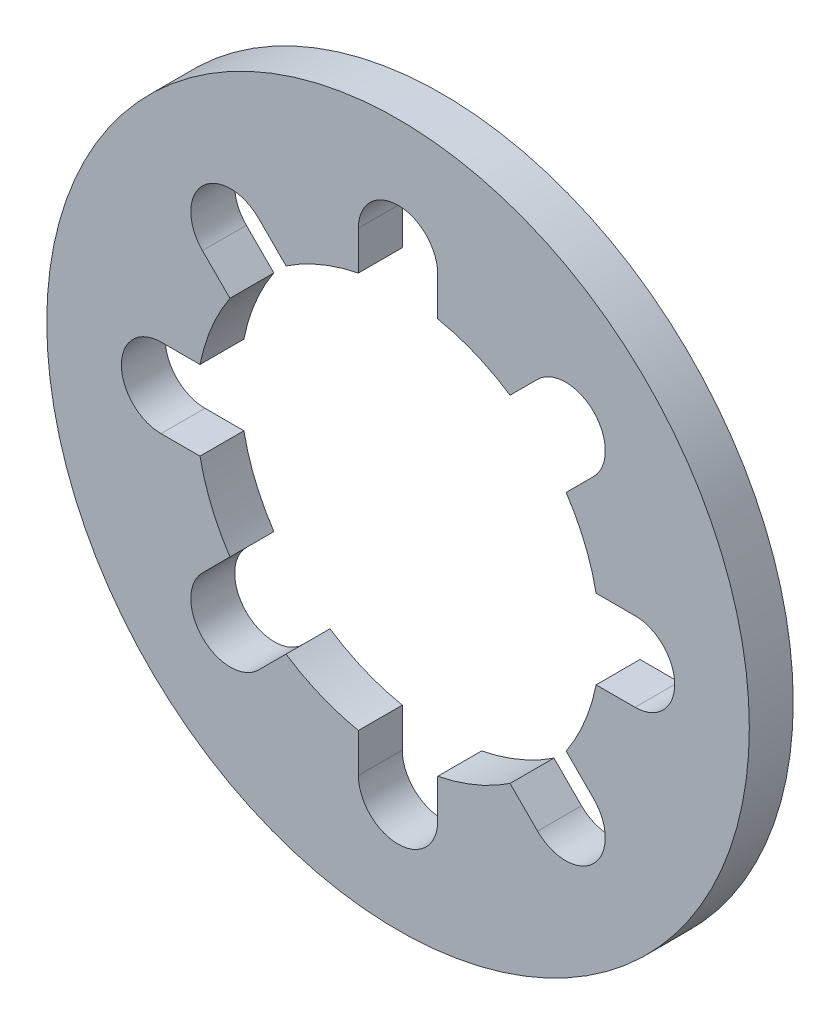
from build123d import *

# Parameters (mm, degrees)
SKETCH1_R          = 4
SKETCH1_R_2        = 2.3
BASE_EXTRUDE_DEPTH = 0.5
TYPEBSLOT_DEPTH    = 10.430473108
TYPEBPATTERN_COUNT = 8


with BuildPart() as part:
    # Sketch1 → Base-Extrude (new body)
    with BuildSketch(Plane.XY):
        Circle(SKETCH1_R)
        Circle(SKETCH1_R_2, mode=Mode.SUBTRACT)
    extrude(amount=-BASE_EXTRUDE_DEPTH)

    # Sketch2 → TypeBSlot (cut, through all)
    with BuildSketch(Plane(origin=(-2.555442923, 2.760916441, 0), x_dir=(1, 0, 0), z_dir=(0, 0, 1))):
        with BuildLine():
            Line((2.10383936, -0.505688244), (2.10383936, -0.062520004))
            ThreePointArc((2.10383936, -0.062520004), (2.555442923, 0.389083559), (3.007046485, -0.062520004))
            Line((3.007046485, -0.062520004), (3.007046485, -0.505688244))
            Line((3.007046485, -0.505688244), (2.10383936, -0.505688244))
        make_face()
    typebslot = extrude(amount=-TYPEBSLOT_DEPTH, mode=Mode.SUBTRACT)

    # TypeBPattern: TypeBSlot ×8 about axis
    typebpattern_axis = Axis((0, 0, -0.5), (0, 0, 1))
    for i in range(1, TYPEBPATTERN_COUNT):
        add(typebslot.rotate(typebpattern_axis, i * 360 / TYPEBPATTERN_COUNT), mode=Mode.SUBTRACT)


solid = part.part
